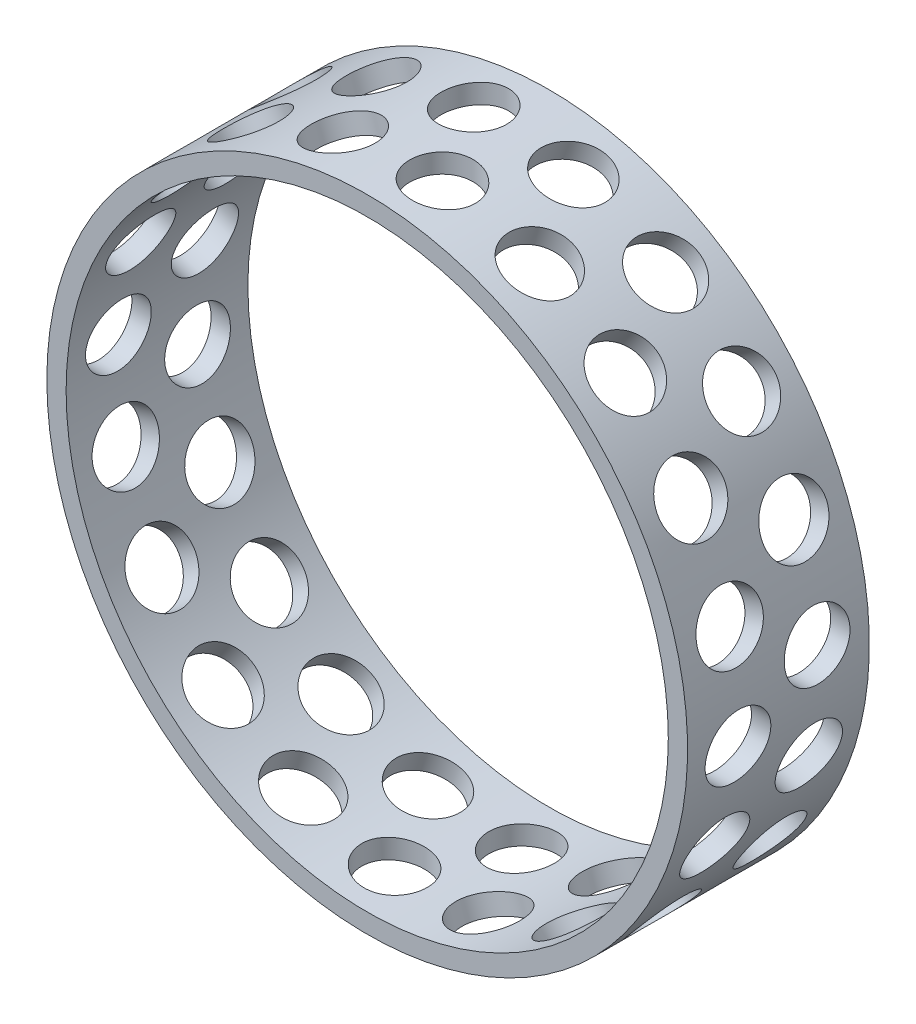
from build123d import *

# Parameters (mm, degrees)
SKETCH1_W          = 47.15
SKETCH1_H          = 5
SKETCH2_R          = 8.5
CUT_EXTRUDE1_DEPTH = 128.002411725
CIRPATTERN1_COUNT  = 20


with BuildPart() as part:
    # Sketch1 → Revolve1 (revolve)
    with BuildSketch(Plane(origin=(0, 0, 0), x_dir=(0, 0, -1), z_dir=(1, 0, 0))):
        with Locations((24.575, 80.59991)):
            Rectangle(SKETCH1_W, SKETCH1_H)
    revolve(axis=Axis((0, 0, -50.5075), (0, 0, 1)))

    # Sketch2 → Cut-Extrude1 (cut, through all)
    with BuildSketch(Plane(origin=(0, 0, 0), x_dir=(0, 0, -1), z_dir=(1, 0, 0))):
        with Locations((14.309765987, 6.214899086)):
            Circle(SKETCH2_R)
        with Locations((34.840234013, -6.214899086)):
            Circle(SKETCH2_R)
    cut_extrude1 = extrude(amount=-CUT_EXTRUDE1_DEPTH, mode=Mode.SUBTRACT)

    # CirPattern1: Cut-Extrude1 ×20 about axis
    cirpattern1_axis = Axis((0, 0, -50.5075), (0, 0, 1))
    for i in range(1, CIRPATTERN1_COUNT):
        add(cut_extrude1.rotate(cirpattern1_axis, i * 360 / CIRPATTERN1_COUNT), mode=Mode.SUBTRACT)


solid = part.part
